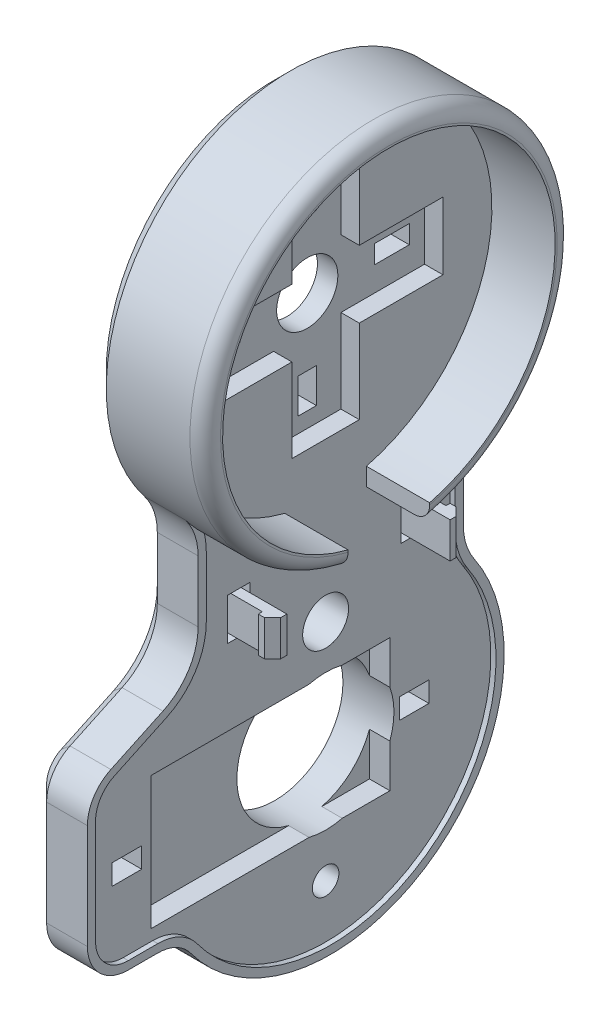
from build123d import *

# Parameters (mm, degrees)
BOSS_EXTRUDE1_START  = -60.6
BOSS_EXTRUDE1_DEPTH  = 5.5
BOSS_EXTRUDE2_START  = -55.6
BOSS_EXTRUDE2_DEPTH  = 0.6
BOSS_EXTRUDE3_START  = -55.6
SKETCH3_R            = 18
SKETCH3_R_2          = 16.3
BOSS_EXTRUDE3_DEPTH  = 6.2
CHAMFER1_SIZE        = 1.5
FILLET1_R            = 1.5
BOSS_EXTRUDE4_START  = 62.7
SKETCH4_W            = 2.3
SKETCH4_H            = 23
BOSS_EXTRUDE4_DEPTH  = 6.6
BOSS_EXTRUDE5_START  = 54.5
SKETCH5_W            = 2.3
SKETCH5_H            = 6.6
BOSS_EXTRUDE5_DEPTH  = 23
BOSS_EXTRUDE6_START  = -57.4
SKETCH6_R            = 4.6
BOSS_EXTRUDE6_DEPTH  = 2.3
BOSS_EXTRUDE7_START  = -61.1
SKETCH7_R            = 6.1
BOSS_EXTRUDE7_DEPTH  = 1.7
BOSS_EXTRUDE8_START  = -59.5
SKETCH8_R            = 3
BOSS_EXTRUDE8_DEPTH  = 2.2
BOSS_EXTRUDE9_START  = 65.1
SKETCH9_W            = 2.3
SKETCH9_H            = 3.4
BOSS_EXTRUDE9_DEPTH  = 1.8
BOSS_EXTRUDE10_START = 72.6
SKETCH10_W           = 2.3
SKETCH10_H           = 1.8
BOSS_EXTRUDE10_DEPTH = 3.4
BOSS_EXTRUDE11_START = 65.1
SKETCH11_W           = 2.3
SKETCH11_H           = 3.4
BOSS_EXTRUDE11_DEPTH = 1.8
BOSS_EXTRUDE12_START = 56
SKETCH12_W           = 2.3
SKETCH12_H           = 1.8
BOSS_EXTRUDE12_DEPTH = 3.4
BOSS_EXTRUDE13_START = 62
SKETCH13_W           = 6.3
SKETCH13_H           = 3.098417801
BOSS_EXTRUDE13_DEPTH = 8
BOSS_EXTRUDE14_START = 55.875
SKETCH14_W           = 4.1
SKETCH14_H           = 2
BOSS_EXTRUDE14_DEPTH = 2.9
BOSS_EXTRUDE15_START = 84.025
SKETCH15_W           = 4.1
SKETCH15_H           = 2
BOSS_EXTRUDE15_DEPTH = 2.9
BOSS_EXTRUDE16_START = 59.7
SKETCH16_W           = 2.1
SKETCH16_H           = 13
BOSS_EXTRUDE16_DEPTH = 23.4
BOSS_EXTRUDE17_START = -61.1
SKETCH17_R           = 6.7
BOSS_EXTRUDE17_DEPTH = 5.6
BOSS_EXTRUDE18_START = -61.1
SKETCH18_R           = 2.25
BOSS_EXTRUDE18_DEPTH = 5.6
BOSS_EXTRUDE19_START = -61.1
SKETCH19_R           = 2.3
BOSS_EXTRUDE19_DEPTH = 1.9
BOSS_EXTRUDE20_START = -59.25
SKETCH20_R           = 1.3
BOSS_EXTRUDE20_DEPTH = 3.75
BOSS_EXTRUDE21_START = 56.4
SKETCH21_W           = 3.1
SKETCH21_H           = 4.1
BOSS_EXTRUDE21_DEPTH = 2.2
BOSS_EXTRUDE22_START = -5.75
BOSS_EXTRUDE22_DEPTH = 3.5
BOSS_EXTRUDE23_START = 73.4
SKETCH23_W           = 3.1
SKETCH23_H           = 4.1
BOSS_EXTRUDE23_DEPTH = 2.2
BOSS_EXTRUDE24_START = -5.75
BOSS_EXTRUDE24_DEPTH = 3.5


with BuildPart() as part:
    # Sketch1 → Boss-Extrude1 (new body)
    with BuildSketch(Plane(origin=(0, 0, 0), x_dir=(0, 0, -1), z_dir=(1, 0, 0)).offset(BOSS_EXTRUDE1_START)):
        with BuildLine():
            Line((-53, 3.337121701), (-53, -7.038518603))
            ThreePointArc((-53, -7.038518603), (-52.733198515, -8.807822077), (-51.956521739, -10.41977462))
            ThreePointArc((-51.956521739, -10.41977462), (-56.18950583, -33.883594784), (-79.719936005, -30.038095238))
            ThreePointArc((-79.719936005, -30.038095238), (-81.138131249, -28.832955071), (-82.948156242, -28.4))
            Line((-82.948156242, -28.4), (-85.85, -28.4))
            ThreePointArc((-85.85, -28.4), (-88.678427125, -27.228427125), (-89.85, -24.4))
            Line((-89.85, -24.4), (-89.85, -14.139667829))
            ThreePointArc((-89.85, -14.139667829), (-89.226856881, -11.995644133), (-87.551581196, -10.519637244))
            Line((-87.551581196, -10.519637244), (-82.447628205, -8.120544133))
            ThreePointArc((-82.447628205, -8.120544133), (-79.934714679, -5.9065338), (-79, -2.690498257))
            Line((-79, -2.690498257), (-79, 3.337121701))
            ThreePointArc((-79, 3.337121701), (-79.321091654, 5.273613374), (-80.25, 7.002841276))
            ThreePointArc((-80.25, 7.002841276), (-66, 36), (-51.75, 7.002841276))
            ThreePointArc((-51.75, 7.002841276), (-52.678908346, 5.273613374), (-53, 3.337121701))
        make_face()
    extrude(amount=BOSS_EXTRUDE1_DEPTH)


with BuildPart() as body_2:
    # Sketch2 → Boss-Extrude2 (new body)
    with BuildSketch(Plane(origin=(0, 0, 0), x_dir=(0, 0, -1), z_dir=(1, 0, 0)).offset(BOSS_EXTRUDE2_START)):
        with BuildLine():
            Line((-53.8, 3.337121701), (-53.8, -7.038518603))
            ThreePointArc((-53.8, -7.038518603), (-53.497624984, -9.043729207), (-52.617391304, -10.870608755))
            ThreePointArc((-52.617391304, -10.870608755), (-56.651176143, -33.230249147), (-79.074291958, -29.565714286))
            ThreePointArc((-79.074291958, -29.565714286), (-80.77612625, -28.119546085), (-82.948156242, -27.6))
            Line((-82.948156242, -27.6), (-85.85, -27.6))
            ThreePointArc((-85.85, -27.6), (-88.1127417, -26.6627417), (-89.05, -24.4))
            Line((-89.05, -24.4), (-89.05, -14.139667829))
            ThreePointArc((-89.05, -14.139667829), (-88.551485505, -12.424448872), (-87.211264957, -11.243643361))
            Line((-87.211264957, -11.243643361), (-82.107311966, -8.84455025))
            ThreePointArc((-82.107311966, -8.84455025), (-79.259343303, -6.335338539), (-78.2, -2.690498257))
            Line((-78.2, -2.690498257), (-78.2, 3.337121701))
            ThreePointArc((-78.2, 3.337121701), (-78.563903875, 5.531812264), (-79.616666667, 7.491603886))
            ThreePointArc((-79.616666667, 7.491603886), (-66, 35.2), (-52.383333333, 7.491603886))
            ThreePointArc((-52.383333333, 7.491603886), (-53.436096125, 5.531812264), (-53.8, 3.337121701))
        make_face()
    extrude(amount=BOSS_EXTRUDE2_DEPTH)


with BuildPart() as part_1:
    add(part.part)

    # Combine1: cut body 2
    add(body_2.part, mode=Mode.SUBTRACT)

    # Sketch3 → Boss-Extrude3 (add)
    with BuildSketch(Plane(origin=(0, 0, 0), x_dir=(0, 0, -1), z_dir=(1, 0, 0)).offset(BOSS_EXTRUDE3_START)):
        with Locations(Location((-66, 18, 0), (0, 0, 217.658462006))):
            Circle(SKETCH3_R)
        with Locations((-66, 18)):
            Circle(SKETCH3_R_2, mode=Mode.SUBTRACT)
    extrude(amount=BOSS_EXTRUDE3_DEPTH)

    # Chamfer1
    chamfer1_edges = [part_1.edges().sort_by_distance(p)[0] for p in [
        (-60.6, 36, 66),
        (-60.6, 5.273613374, 52.678908346),
        (-60.6, -1.850698451, 53),
        (-60.6, -8.807822077, 52.733198515),
        (-60.6, -33.883594784, 56.18950583),
        (-60.6, -28.832955071, 81.138131249),
        (-60.6, -28.4, 84.399078121),
        (-60.6, -27.228427125, 88.678427125),
        (-60.6, -19.269833914, 89.85),
        (-60.6, -11.995644133, 89.226856881),
        (-60.6, -9.320090689, 84.999604701),
        (-60.6, -5.9065338, 79.934714679),
        (-60.6, 0.323311722, 79),
        (-60.6, 5.273613374, 79.321091654),
    ]]
    chamfer(chamfer1_edges, length=CHAMFER1_SIZE)

    # Fillet1
    fillet1_edges = [part_1.edges().sort_by_distance(p)[0] for p in [
        (-49.4, 28.997158724, 51.75),
    ]]
    fillet(fillet1_edges, radius=FILLET1_R)


with BuildPart() as body_2_2:
    # Sketch4 → Boss-Extrude4 (new body)
    with BuildSketch(Plane.XY.offset(BOSS_EXTRUDE4_START)):
        with Locations((-56.25, 18)):
            Rectangle(SKETCH4_W, SKETCH4_H)
    extrude(amount=BOSS_EXTRUDE4_DEPTH)


with BuildPart() as part_2:
    add(part_1.part)

    # Combine2: cut body 2 2
    add(body_2_2.part, mode=Mode.SUBTRACT)


with BuildPart() as body_2_3:
    # Sketch5 → Boss-Extrude5 (new body)
    with BuildSketch(Plane.XY.offset(BOSS_EXTRUDE5_START)):
        with Locations((-56.25, 18)):
            Rectangle(SKETCH5_W, SKETCH5_H)
    extrude(amount=BOSS_EXTRUDE5_DEPTH)


with BuildPart() as part_3:
    add(part_2.part)

    # Combine3: cut body 2 3
    add(body_2_3.part, mode=Mode.SUBTRACT)


with BuildPart() as body_2_4:
    # Sketch6 → Boss-Extrude6 (new body)
    with BuildSketch(Plane(origin=(0, 0, 0), x_dir=(0, 0, -1), z_dir=(1, 0, 0)).offset(BOSS_EXTRUDE6_START)):
        with Locations((-66, 18)):
            Circle(SKETCH6_R)
    extrude(amount=BOSS_EXTRUDE6_DEPTH)


with BuildPart() as part_4:
    add(part_3.part)

    # Combine4: cut body 2 4
    add(body_2_4.part, mode=Mode.SUBTRACT)


with BuildPart() as body_2_5:
    # Sketch7 → Boss-Extrude7 (new body)
    with BuildSketch(Plane(origin=(0, 0, 0), x_dir=(0, 0, -1), z_dir=(1, 0, 0)).offset(BOSS_EXTRUDE7_START)):
        with Locations((-66, 18)):
            Circle(SKETCH7_R)
    extrude(amount=BOSS_EXTRUDE7_DEPTH)


with BuildPart() as part_5:
    add(part_4.part)

    # Combine5: cut body 2 5
    add(body_2_5.part, mode=Mode.SUBTRACT)


with BuildPart() as body_2_6:
    # Sketch8 → Boss-Extrude8 (new body)
    with BuildSketch(Plane(origin=(0, 0, 0), x_dir=(0, 0, -1), z_dir=(1, 0, 0)).offset(BOSS_EXTRUDE8_START)):
        with Locations((-66, 18)):
            Circle(SKETCH8_R)
    extrude(amount=BOSS_EXTRUDE8_DEPTH)


with BuildPart() as part_6:
    add(part_5.part)

    # Combine6: cut body 2 6
    add(body_2_6.part, mode=Mode.SUBTRACT)


with BuildPart() as body_2_7:
    # Sketch9 → Boss-Extrude9 (new body)
    with BuildSketch(Plane.XY.offset(BOSS_EXTRUDE9_START)):
        with Locations((-58.45, 26.3)):
            Rectangle(SKETCH9_W, SKETCH9_H)
    extrude(amount=BOSS_EXTRUDE9_DEPTH)


with BuildPart() as part_7:
    add(part_6.part)

    # Combine7: cut body 2 7
    add(body_2_7.part, mode=Mode.SUBTRACT)


with BuildPart() as body_2_8:
    # Sketch10 → Boss-Extrude10 (new body)
    with BuildSketch(Plane.XY.offset(BOSS_EXTRUDE10_START)):
        with Locations((-58.45, 18)):
            Rectangle(SKETCH10_W, SKETCH10_H)
    extrude(amount=BOSS_EXTRUDE10_DEPTH)


with BuildPart() as part_8:
    add(part_7.part)

    # Combine8: cut body 2 8
    add(body_2_8.part, mode=Mode.SUBTRACT)


with BuildPart() as body_2_9:
    # Sketch11 → Boss-Extrude11 (new body)
    with BuildSketch(Plane.XY.offset(BOSS_EXTRUDE11_START)):
        with Locations((-58.45, 9.7)):
            Rectangle(SKETCH11_W, SKETCH11_H)
    extrude(amount=BOSS_EXTRUDE11_DEPTH)


with BuildPart() as part_9:
    add(part_8.part)

    # Combine9: cut body 2 9
    add(body_2_9.part, mode=Mode.SUBTRACT)


with BuildPart() as body_2_10:
    # Sketch12 → Boss-Extrude12 (new body)
    with BuildSketch(Plane.XY.offset(BOSS_EXTRUDE12_START)):
        with Locations((-58.45, 18)):
            Rectangle(SKETCH12_W, SKETCH12_H)
    extrude(amount=BOSS_EXTRUDE12_DEPTH)


with BuildPart() as part_10:
    add(part_9.part)

    # Combine10: cut body 2 10
    add(body_2_10.part, mode=Mode.SUBTRACT)


with BuildPart() as body_2_11:
    # Sketch13 → Boss-Extrude13 (new body)
    with BuildSketch(Plane.XY.offset(BOSS_EXTRUDE13_START)):
        with Locations((-52.45, 0.9492089)):
            Rectangle(SKETCH13_W, SKETCH13_H)
    extrude(amount=BOSS_EXTRUDE13_DEPTH)


with BuildPart() as part_11:
    add(part_10.part)

    # Combine11: cut body 2 11
    add(body_2_11.part, mode=Mode.SUBTRACT)


with BuildPart() as body_2_12:
    # Sketch14 → Boss-Extrude14 (new body)
    with BuildSketch(Plane.XY.offset(BOSS_EXTRUDE14_START)):
        with Locations((-57.55, -20)):
            Rectangle(SKETCH14_W, SKETCH14_H)
    extrude(amount=BOSS_EXTRUDE14_DEPTH)


with BuildPart() as part_12:
    add(part_11.part)

    # Combine12: cut body 2 12
    add(body_2_12.part, mode=Mode.SUBTRACT)


with BuildPart() as body_2_13:
    # Sketch15 → Boss-Extrude15 (new body)
    with BuildSketch(Plane.XY.offset(BOSS_EXTRUDE15_START)):
        with Locations((-57.55, -20)):
            Rectangle(SKETCH15_W, SKETCH15_H)
    extrude(amount=BOSS_EXTRUDE15_DEPTH)


with BuildPart() as part_13:
    add(part_12.part)

    # Combine13: cut body 2 13
    add(body_2_13.part, mode=Mode.SUBTRACT)


with BuildPart() as body_2_14:
    # Sketch16 → Boss-Extrude16 (new body)
    with BuildSketch(Plane.XY.offset(BOSS_EXTRUDE16_START)):
        with Locations((-56.55, -20)):
            Rectangle(SKETCH16_W, SKETCH16_H)
    extrude(amount=BOSS_EXTRUDE16_DEPTH)


with BuildPart() as part_14:
    add(part_13.part)

    # Combine14: cut body 2 14
    add(body_2_14.part, mode=Mode.SUBTRACT)


with BuildPart() as body_2_15:
    # Sketch17 → Boss-Extrude17 (new body)
    with BuildSketch(Plane(origin=(0, 0, 0), x_dir=(0, 0, -1), z_dir=(1, 0, 0)).offset(BOSS_EXTRUDE17_START)):
        with Locations((-66, -20)):
            Circle(SKETCH17_R)
    extrude(amount=BOSS_EXTRUDE17_DEPTH)


with BuildPart() as part_15:
    add(part_14.part)

    # Combine15: cut body 2 15
    add(body_2_15.part, mode=Mode.SUBTRACT)


with BuildPart() as body_2_16:
    # Sketch18 → Boss-Extrude18 (new body)
    with BuildSketch(Plane(origin=(0, 0, 0), x_dir=(0, 0, -1), z_dir=(1, 0, 0)).offset(BOSS_EXTRUDE18_START)):
        with Locations((-66, -9)):
            Circle(SKETCH18_R)
    extrude(amount=BOSS_EXTRUDE18_DEPTH)


with BuildPart() as part_16:
    add(part_15.part)

    # Combine16: cut body 2 16
    add(body_2_16.part, mode=Mode.SUBTRACT)


with BuildPart() as body_2_17:
    # Sketch19 → Boss-Extrude19 (new body)
    with BuildSketch(Plane(origin=(0, 0, 0), x_dir=(0, 0, -1), z_dir=(1, 0, 0)).offset(BOSS_EXTRUDE19_START)):
        with Locations((-66, -31)):
            Circle(SKETCH19_R)
    extrude(amount=BOSS_EXTRUDE19_DEPTH)


with BuildPart() as part_17:
    add(part_16.part)

    # Combine17: cut body 2 17
    add(body_2_17.part, mode=Mode.SUBTRACT)


with BuildPart() as body_2_18:
    # Sketch20 → Boss-Extrude20 (new body)
    with BuildSketch(Plane(origin=(0, 0, 0), x_dir=(0, 0, -1), z_dir=(1, 0, 0)).offset(BOSS_EXTRUDE20_START)):
        with Locations((-66, -31)):
            Circle(SKETCH20_R)
    extrude(amount=BOSS_EXTRUDE20_DEPTH)


with BuildPart() as part_18:
    add(part_17.part)

    # Combine18: cut body 2 18
    add(body_2_18.part, mode=Mode.SUBTRACT)


with BuildPart() as body_2_19:
    # Sketch21 → Boss-Extrude21 (new body)
    with BuildSketch(Plane.XY.offset(BOSS_EXTRUDE21_START)):
        with Locations((-57.05, -4)):
            Rectangle(SKETCH21_W, SKETCH21_H)
    extrude(amount=BOSS_EXTRUDE21_DEPTH)


with BuildPart() as part_19:
    add(part_18.part)

    # Combine19: cut body 2 19
    add(body_2_19.part, mode=Mode.SUBTRACT)

    # Sketch22 → Boss-Extrude22 (add)
    with BuildSketch(Plane(origin=(0, 0, 0), x_dir=(1, 0, 0), z_dir=(0, 1, 0)).offset(BOSS_EXTRUDE22_START)):
        Polygon((-58.8, -58), (-58.8, -57), (-52.8, -57), (-52.8, -56.6), (-52.2, -56.6), (-51.4, -57.4), (-51.4, -58), align=None)
    extrude(amount=BOSS_EXTRUDE22_DEPTH)


with BuildPart() as body_2_20:
    # Sketch23 → Boss-Extrude23 (new body)
    with BuildSketch(Plane.XY.offset(BOSS_EXTRUDE23_START)):
        with Locations((-57.05, -4)):
            Rectangle(SKETCH23_W, SKETCH23_H)
    extrude(amount=BOSS_EXTRUDE23_DEPTH)


with BuildPart() as part_20:
    add(part_19.part)

    # Combine20: cut body 2 20
    add(body_2_20.part, mode=Mode.SUBTRACT)

    # Sketch24 → Boss-Extrude24 (add)
    with BuildSketch(Plane(origin=(0, 0, 0), x_dir=(1, 0, 0), z_dir=(0, 1, 0)).offset(BOSS_EXTRUDE24_START)):
        Polygon((-58.8, -74), (-58.8, -75), (-52.8, -75), (-52.8, -75.4), (-52.2, -75.4), (-51.4, -74.6), (-51.4, -74), align=None)
    extrude(amount=BOSS_EXTRUDE24_DEPTH)


solid = part_20.part
